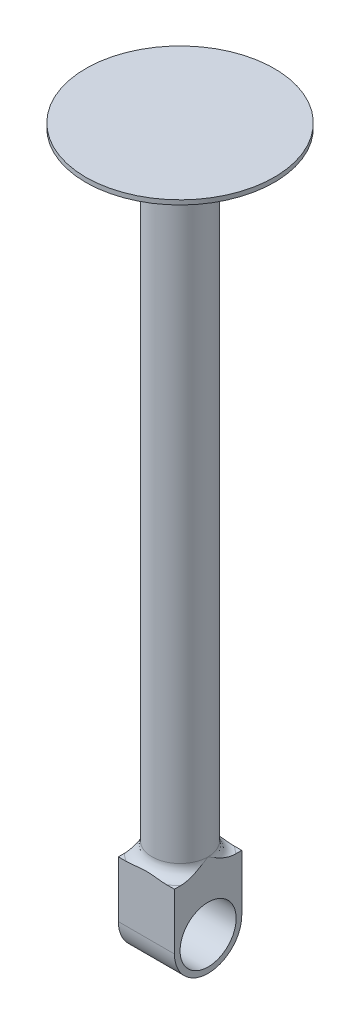
from build123d import *

# Parameters (mm, degrees)
SKETCH1_R           = 15
SKETCH1_R_2         = 12.5
BOSS_EXTRUDE1_DEPTH = 25
CUT_EXTRUDE1_DEPTH  = 280
FILLET1_R           = 5
FILLET2_R           = 5
SKETCH3_R           = 11.5
CUT_EXTRUDE2_DEPTH  = 300
SKETCH4_R           = 42
BOSS_EXTRUDE2_DEPTH = 2


with BuildPart() as part:
    # Sketch1 → Boss-Extrude1 (new body)
    # profile 1 of 2: a face of its own
    with BuildSketch(Plane(origin=(0, 0, 0), x_dir=(0, 0, -1), z_dir=(1, 0, 0))):
        with BuildLine():
            ThreePointArc((-15, 0), (0, 15), (15, 0))
            Line((15, 0), (15, 305))
            Line((15, 305), (-15, 305))
            Line((-15, 305), (-15, 0))
        make_face()
    # profile 2 of 2: a face of its own
    with BuildSketch(Plane(origin=(0, 0, 0), x_dir=(0, 0, -1), z_dir=(1, 0, 0))):
        Circle(SKETCH1_R)
        Circle(SKETCH1_R_2, mode=Mode.SUBTRACT)
    extrude(amount=-BOSS_EXTRUDE1_DEPTH)

    # Sketch2 → Cut-Extrude1 (cut)
    with BuildSketch(Plane(origin=(0, 305, 0), x_dir=(1, 0, 0), z_dir=(0, 1, 0))):
        with BuildLine():
            Line((0, -15), (0, 0))
            ThreePointArc((0, 0), (-12.5, -12.5), (-25, 0))
            Line((-25, 0), (-25, -15))
            Line((-25, -15), (0, -15))
        make_face()
        with BuildLine():
            ThreePointArc((-25, 0), (-12.5, 12.5), (0, 0))
            Line((0, 0), (0, 15))
            Line((0, 15), (-25, 15))
            Line((-25, 15), (-25, 0))
        make_face()
    extrude(amount=-CUT_EXTRUDE1_DEPTH, mode=Mode.SUBTRACT)

    # Fillet1
    # the kernel refuses this fillet: 5 mm, written as the material it adds along each edge
    with BuildSketch(Plane(origin=(-12.5, 25, 0), x_dir=(1, 0, 0), z_dir=(0, 0, -1))) as fillet1_piece_1_section:
        with BuildLine():
            CenterArc((12.5 + FILLET1_R, -FILLET1_R), FILLET1_R, 90, 90)
            Line((12.5, -FILLET1_R), (12.5, 0))
            Line((12.5, 0), (12.5 + FILLET1_R, 0))
        make_face()
    fillet1_piece_1 = revolve(axis=Axis((-12.5, 25, 0), (0, -1, 0)), revolution_arc=180, mode=Mode.PRIVATE)
    fillet1_piece_1 = split(fillet1_piece_1, bisect_by=Plane(origin=(-12.5, 26.425263387, 15), z_dir=(0, 0, -1)), keep=Keep.TOP, mode=Mode.PRIVATE)
    fillet1_piece_1 = split(fillet1_piece_1, bisect_by=Plane(origin=(-25, 26.425263387, 13.925263387), z_dir=(1, 0, 0)), keep=Keep.TOP, mode=Mode.PRIVATE)
    fillet1_piece_1 = split(fillet1_piece_1, bisect_by=Plane(origin=(0, 26.425263387, 13.925263387), z_dir=(-1, 0, 0)), keep=Keep.TOP, mode=Mode.PRIVATE)
    add(fillet1_piece_1)

    # Fillet2
    # the kernel refuses this fillet: 5 mm, written as the material it adds along each edge
    with BuildSketch(Plane(origin=(-12.5, 25, 0), x_dir=(-0.5389483633149527, 0, 0.8423388045674577), z_dir=(0.8423388045674577, 0, 0.5389483633149527))) as fillet2_piece_1_section:
        with BuildLine():
            CenterArc((12.5 + FILLET2_R, -FILLET2_R), FILLET2_R, 90, 90)
            Line((12.5 + FILLET2_R, 0), (12.5, 0))
            Line((12.5, 0), (12.5, -FILLET2_R))
        make_face()
    fillet2_piece_1 = revolve(axis=Axis((-12.5, 25, 0), (0, -1, 0)), revolution_arc=294.775843921, mode=Mode.PRIVATE)
    fillet2_piece_1 = split(fillet2_piece_1, bisect_by=Plane(origin=(-25, 27.5000003, -12.555440979), z_dir=(1, 0, 0)), keep=Keep.TOP, mode=Mode.PRIVATE)
    fillet2_piece_1 = split(fillet2_piece_1, bisect_by=Plane(origin=(0, 27.5000003, -12.555440979), z_dir=(-1, 0, 0)), keep=Keep.TOP, mode=Mode.PRIVATE)
    fillet2_piece_1 = split(fillet2_piece_1, bisect_by=Plane(origin=(-12.5, 27.5000003, -15), z_dir=(0, 0, 1)), keep=Keep.TOP, mode=Mode.PRIVATE)
    add(fillet2_piece_1)

    # Sketch3 → Cut-Extrude2 (cut)
    with BuildSketch(Plane(origin=(0, 305, 0), x_dir=(1, 0, 0), z_dir=(0, 1, 0))):
        with Locations(Location((-12.5, 0, 0), (0, 0, 270))):
            Circle(SKETCH3_R)
    extrude(amount=-CUT_EXTRUDE2_DEPTH, mode=Mode.SUBTRACT)

    # Sketch4 → Boss-Extrude2 (add)
    with BuildSketch(Plane(origin=(0, 305, 0), x_dir=(1, 0, 0), z_dir=(0, 1, 0))):
        with Locations(Location((-12.5, 0, 0), (0, 0, 270))):
            Circle(SKETCH4_R)
    extrude(amount=BOSS_EXTRUDE2_DEPTH)


solid = part.part
